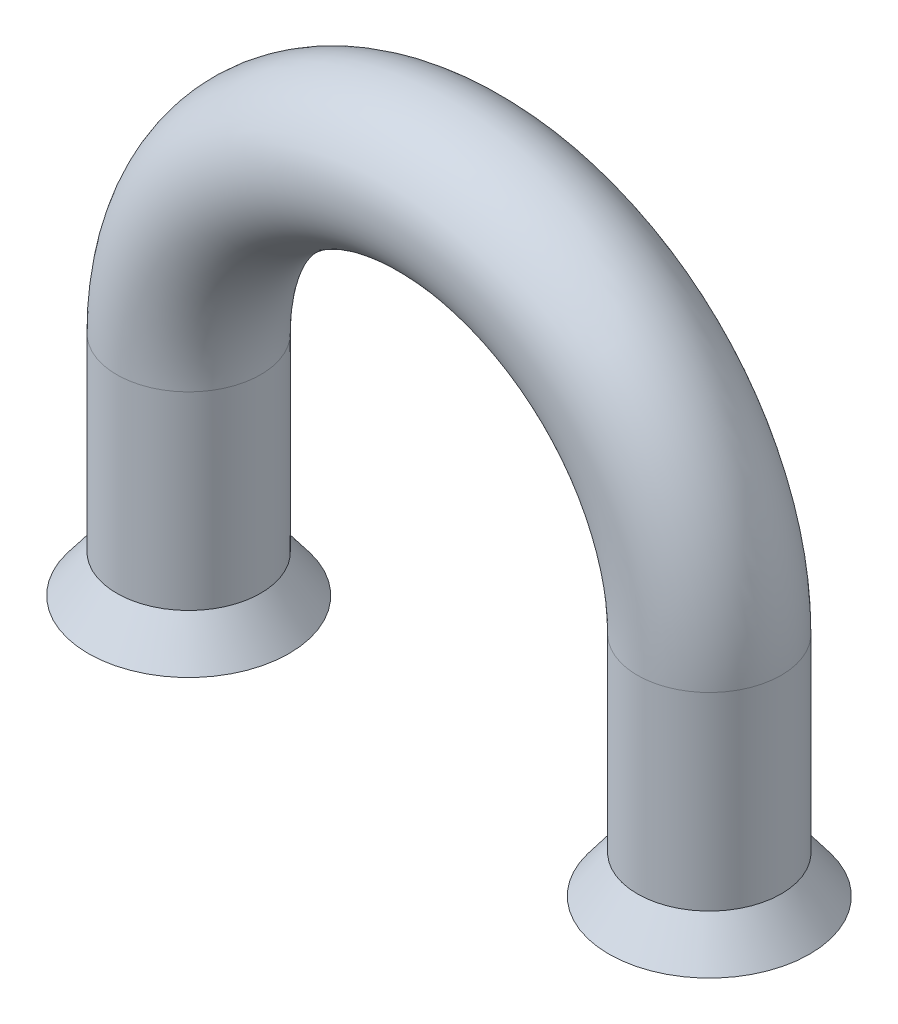
from build123d import *

# Parameters (mm, degrees)
SKETCH1_R           = 4.826
SKETCH1_R_2         = 4.064
SKETCH3_R           = 4.826
BOSS_EXTRUDE1_DEPTH = 2.54
BOSS_EXTRUDE1_DRAFT = -37
SKETCH5_R           = 4.826
BOSS_EXTRUDE2_DEPTH = 2.54
BOSS_EXTRUDE2_DRAFT = -37


with BuildPart() as part:
    # Sweep1: sweep along a path in Sketch2
    with BuildLine(Plane.XY) as sweep1_path:
        Line((0, 0), (0, 12.7))
        ThreePointArc((0, 12.7), (17.4625, 30.1625), (34.925, 12.7))
        Line((34.925, 12.7), (34.925, 0))
    # Sketch1 → Sweep1 (sweep)
    with BuildSketch(Plane(origin=(0, 0, 0), x_dir=(1, 0, 0), z_dir=(0, 1, 0))):
        Circle(SKETCH1_R)
        Circle(SKETCH1_R_2, mode=Mode.SUBTRACT)
    sweep(path=sweep1_path.line)


with BuildPart() as boss_extrude1_tool:
    # Sketch3 → Boss-Extrude1 (with draft: the straight prism first)
    with BuildSketch(Plane.XZ):
        Circle(SKETCH3_R)
    extrude(amount=BOSS_EXTRUDE1_DEPTH)
    # Boss-Extrude1: the draft: its side faces are tilted about the plane it starts from
    boss_extrude1_sides = [boss_extrude1_tool.faces().sort_by_distance(p)[0] for p in [
        (-4.826, -1.27, 0),
    ]]
    draft(boss_extrude1_sides, Plane.XZ, BOSS_EXTRUDE1_DRAFT)


with BuildPart() as part_1:
    add(part.part)

    # Boss-Extrude1: add boss_extrude1_tool
    add(boss_extrude1_tool.part)

    # Cut-Extrude1 cone 1 section (through the dimple's axis) → Cut-Extrude1 (revolve, cut)
    with BuildSketch(Plane(origin=(0, -2.54, 0), x_dir=(0, 0, -1), z_dir=(1, 0, 0))):
        Polygon((0, 0), (5.978027287, 0), (0, 7.933110155), align=None)
    revolve(axis=Axis((0, -2.54, 0), (0, 1, 0)), mode=Mode.SUBTRACT)


with BuildPart() as boss_extrude2_tool:
    # Sketch5 → Boss-Extrude2 (with draft: the straight prism first)
    with BuildSketch(Plane(origin=(0, 0, 0), x_dir=(0, 0, -1), z_dir=(0, -1, 0))):
        with Locations((0, 34.925)):
            Circle(SKETCH5_R)
    extrude(amount=BOSS_EXTRUDE2_DEPTH)
    # Boss-Extrude2: the draft: its side faces are tilted about the plane it starts from
    boss_extrude2_sides = [boss_extrude2_tool.faces().sort_by_distance(p)[0] for p in [
        (34.925, -1.27, 4.826),
    ]]
    draft(boss_extrude2_sides, Plane(origin=(0, 0, 0), x_dir=(0, 0, -1), z_dir=(0, -1, 0)), BOSS_EXTRUDE2_DRAFT)


with BuildPart() as part_2:
    add(part_1.part)

    # Boss-Extrude2: add boss_extrude2_tool
    add(boss_extrude2_tool.part)

    # Cut-Extrude2 cone 1 section (through the dimple's axis) → Cut-Extrude2 (revolve, cut)
    with BuildSketch(Plane(origin=(34.925, -2.54, 0), x_dir=(0, 0, -1), z_dir=(1, 0, 0))):
        Polygon((0, 0), (5.978027287, 0), (0, 7.933110155), align=None)
    revolve(axis=Axis((34.925, -2.54, 0), (0, 1, 0)), mode=Mode.SUBTRACT)


solid = part_2.part
